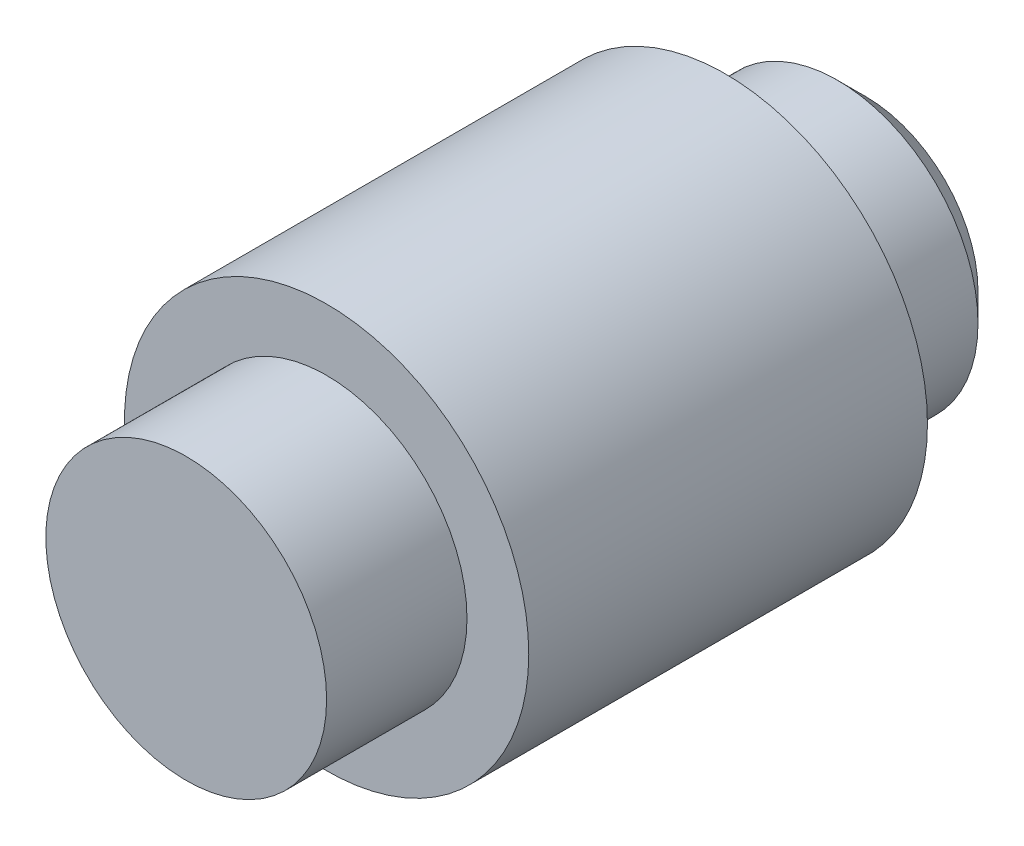
from build123d import *

# Parameters (mm, degrees)
SKETCH3_R           = 3.6
BOSS_EXTRUDE1_DEPTH = 7.1
SKETCH4_R           = 2.5
BOSS_EXTRUDE2_DEPTH = 2.5
BOSS_EXTRUDE3_START = 2.5
SKETCH5_R           = 2.5
BOSS_EXTRUDE3_DEPTH = 2.5
CHAMFER1_SIZE       = 0.5


with BuildPart() as part:
    # Sketch3 → Boss-Extrude1 (new body)
    with BuildSketch(Plane.XY):
        Circle(SKETCH3_R)
    extrude(amount=BOSS_EXTRUDE1_DEPTH)

    # Sketch4 → Boss-Extrude2 (add)
    with BuildSketch(Plane.XY):
        Circle(SKETCH4_R)
    extrude(amount=-BOSS_EXTRUDE2_DEPTH)

    # Sketch5 → Boss-Extrude3 (add)
    with BuildSketch(Plane.XY.offset(7.1).offset(BOSS_EXTRUDE3_START)):
        Circle(SKETCH5_R)
    extrude(amount=-BOSS_EXTRUDE3_DEPTH)

    # Chamfer1
    chamfer1_edges = [part.edges().sort_by_distance(p)[0] for p in [
        (-2.5, 0, -2.5),
    ]]
    chamfer(chamfer1_edges, length=CHAMFER1_SIZE)


solid = part.part
